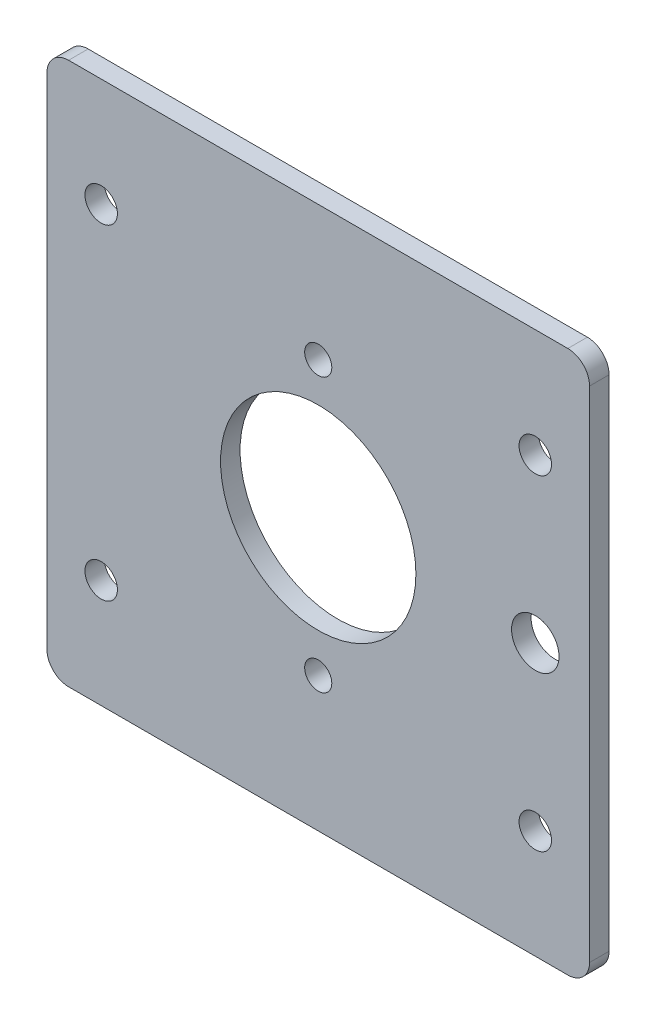
from build123d import *

# Parameters (mm, degrees)
SKETCH3_W                       = 63.5
SKETCH3_H                       = 2.286
BASE_FLANGE1_DEPTH              = 31.75
FILLET1_R                       = 2.54
F_25_0_1495_DIAMETER_HOLE1_D    = 3.7973
SKETCH10_R                      = 11.43
CUT_EXTRUDE1_DEPTH              = 45.959435005
F_7_32_0_21875_DIAMETER_HOLE1_D = 5.55625
F_1_8_0_125_DIAMETER_HOLE1_D    = 3.175


# Sheet-metal steps are written as plain solids
with BuildPart() as part:
    # Sketch3 → Base-Flange1 (new, symmetric)
    with BuildSketch(Plane(origin=(0, 0, 0), x_dir=(-1, 0, 0), z_dir=(0, 1, 0))):
        with Locations((0, -1.143)):
            Rectangle(SKETCH3_W, SKETCH3_H)
    extrude(amount=BASE_FLANGE1_DEPTH, both=True)

    # Fillet1
    fillet1_edges = [part.edges().sort_by_distance(p)[0] for p in [
        (31.75, 31.75, -1.143),
        (31.75, -31.75, -1.143),
        (-31.75, -31.75, -1.143),
        (-31.75, 31.75, -1.143),
    ]]
    fillet(fillet1_edges, radius=FILLET1_R)

    # #25 (0.1495) Diameter Hole1 (through all)
    with Locations(Plane.XY):
        with Locations((-25.4, 19.05), (25.4, 19.05), (25.4, -19.05), (-25.4, -19.05)):
            Hole(F_25_0_1495_DIAMETER_HOLE1_D / 2)

    # Sketch10 → Cut-Extrude1 (cut, through all)
    with BuildSketch(Plane.XY):
        Circle(SKETCH10_R)
    extrude(amount=-CUT_EXTRUDE1_DEPTH, mode=Mode.SUBTRACT)

    # 7/32 (0.21875) Diameter Hole1 (through all)
    with Locations(Plane.XY):
        with Locations((25.4, 0)):
            Hole(F_7_32_0_21875_DIAMETER_HOLE1_D / 2)

    # 1/8 (0.125) Diameter Hole1 (through all)
    with Locations(Plane.XY):
        with Locations((0, 16), (0, -16)):
            Hole(F_1_8_0_125_DIAMETER_HOLE1_D / 2)


solid = part.part
